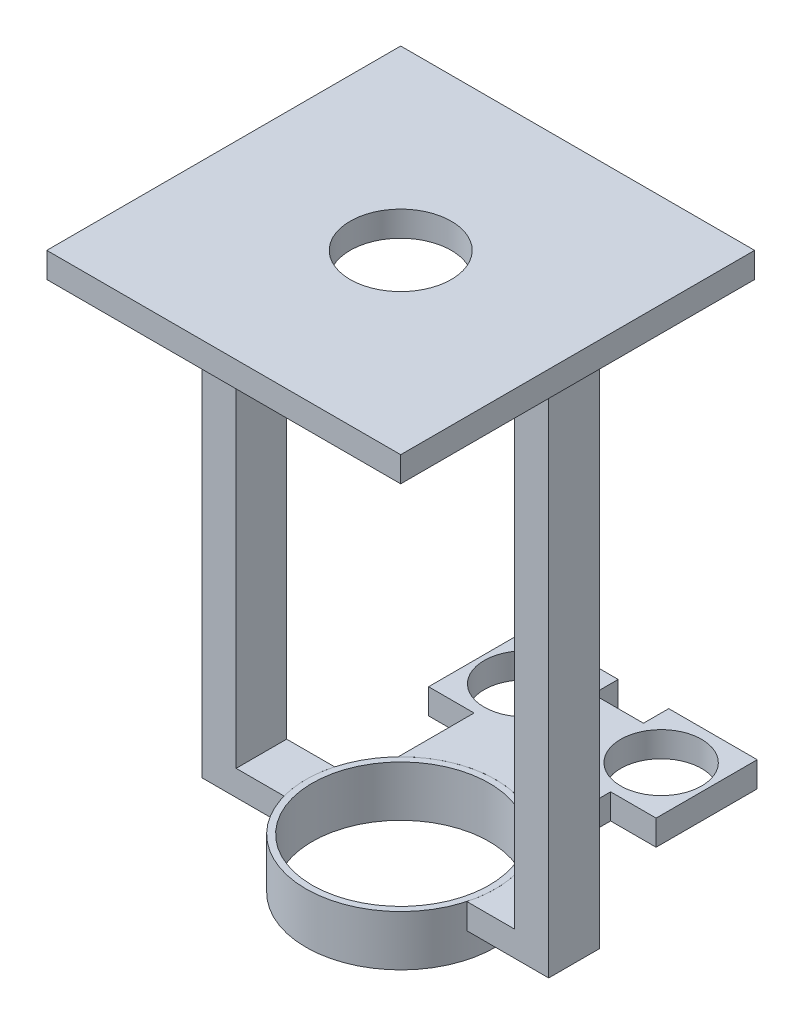
from build123d import *

# Parameters (mm, degrees)
CONNECTOR_SLEEVE_DEPTH      = 5
CONNECTOR_SLEEVE_DEPTH_BACK = 5
SKETCH2_R                   = 18.75
SKETCH2_R_2                 = 17.5
SENSOR_HOLDER_DEPTH         = 5
SKETCH2_10_R                = 8
SENSOR_HOLDER_2_DEPTH       = 5
SENSOR_HOLDER_3_DEPTH       = 5
SKETCH2_18_W                = 6.720509831
SKETCH2_18_H                = 10
BOSS_EXTRUDE1_DEPTH         = 100
SKETCH4_W                   = 70
SKETCH4_H                   = 70
SKETCH4_R                   = 10
BOSS_EXTRUDE2_DEPTH         = 5


with BuildPart() as part:
    # Sketch2 → Connector sleeve (new, two sides: drawn at the far end of the back side and taken through both)
    with BuildSketch(Plane(origin=(0, 0, 0), x_dir=(1, 0, 0), z_dir=(0, 1, 0)).offset(-CONNECTOR_SLEEVE_DEPTH_BACK)):
        Circle(SKETCH2_R)
        Circle(SKETCH2_R_2, mode=Mode.SUBTRACT)
    extrude(amount=CONNECTOR_SLEEVE_DEPTH + CONNECTOR_SLEEVE_DEPTH_BACK)


with BuildPart() as body_2:
    # Sketch2<10> → Sensor holder (new body)
    with BuildSketch(Plane(origin=(0, 0, 0), x_dir=(1, 0, 0), z_dir=(0, 1, 0))):
        with BuildLine():
            Line((-34.270509831, -5), (-18.071040369, -5))
            ThreePointArc((-18.071040369, -5), (-18.75, 0), (-18.071040369, 5))
            Line((-18.071040369, 5), (-34.270509831, 5))
            Line((-34.270509831, 5), (-34.270509831, -5))
        make_face()
    extrude(amount=SENSOR_HOLDER_DEPTH)



with BuildPart() as body_3:
    # Sketch2<10> → Sensor holder 2 (new body)
    with BuildSketch(Plane(origin=(0, 0, 0), x_dir=(1, 0, 0), z_dir=(0, 1, 0))):
        with BuildLine():
            Line((-13.5, 28.01201368), (-13.5, 13.01201368))
            ThreePointArc((-13.5, 13.01201368), (0, 18.75), (13.5, 13.01201368))
            Line((13.5, 13.01201368), (13.5, 28.01201368))
            Line((13.5, 28.01201368), (22.5, 28.01201368))
            Line((22.5, 28.01201368), (22.5, 48.01201368))
            Line((22.5, 48.01201368), (5, 48.01201368))
            Line((5, 48.01201368), (5, 43.01201368))
            Line((5, 43.01201368), (-5, 43.01201368))
            Line((-5, 43.01201368), (-5, 48.01201368))
            Line((-5, 48.01201368), (-22.5, 48.01201368))
            Line((-22.5, 48.01201368), (-22.5, 28.01201368))
            Line((-22.5, 28.01201368), (-13.5, 28.01201368))
        make_face()
        with Locations((-13.5, 38.01201368)):
            Circle(SKETCH2_10_R, mode=Mode.SUBTRACT)
        with Locations((13.5, 38.01201368)):
            Circle(SKETCH2_10_R, mode=Mode.SUBTRACT)
    extrude(amount=SENSOR_HOLDER_2_DEPTH)


with BuildPart() as body_4:
    # Sketch2<10> → Sensor holder 3 (new body)
    with BuildSketch(Plane(origin=(0, 0, 0), x_dir=(1, 0, 0), z_dir=(0, 1, 0))):
        with BuildLine():
            Line((18.071040369, -5), (34.270509831, -5))
            Line((34.270509831, -5), (34.270509831, 5))
            Line((34.270509831, 5), (18.071040369, 5))
            ThreePointArc((18.071040369, 5), (18.75, 0), (18.071040369, -5))
        make_face()
    extrude(amount=SENSOR_HOLDER_3_DEPTH)


with BuildPart() as body_2_1:
    add(body_2.part)

    add(body_4.part)  # Boss-Extrude1 merges body 4
    # Sketch2<18> → Boss-Extrude1 (add)
    with BuildSketch(Plane(origin=(0, 0, 0), x_dir=(1, 0, 0), z_dir=(0, 1, 0))):
        with Locations((-30.910254916, 0)):
            Rectangle(SKETCH2_18_W, SKETCH2_18_H)
        with Locations((30.910254916, 0)):
            Rectangle(SKETCH2_18_W, SKETCH2_18_H)
    extrude(amount=BOSS_EXTRUDE1_DEPTH)

    # Sketch4 → Boss-Extrude2 (add)
    with BuildSketch(Plane(origin=(0, 100, 0), x_dir=(1, 0, 0), z_dir=(0, 1, 0))):
        Rectangle(SKETCH4_W, SKETCH4_H)
        Circle(SKETCH4_R, mode=Mode.SUBTRACT)
    extrude(amount=BOSS_EXTRUDE2_DEPTH)


solid = Compound([part.part, body_3.part, body_2_1.part])
